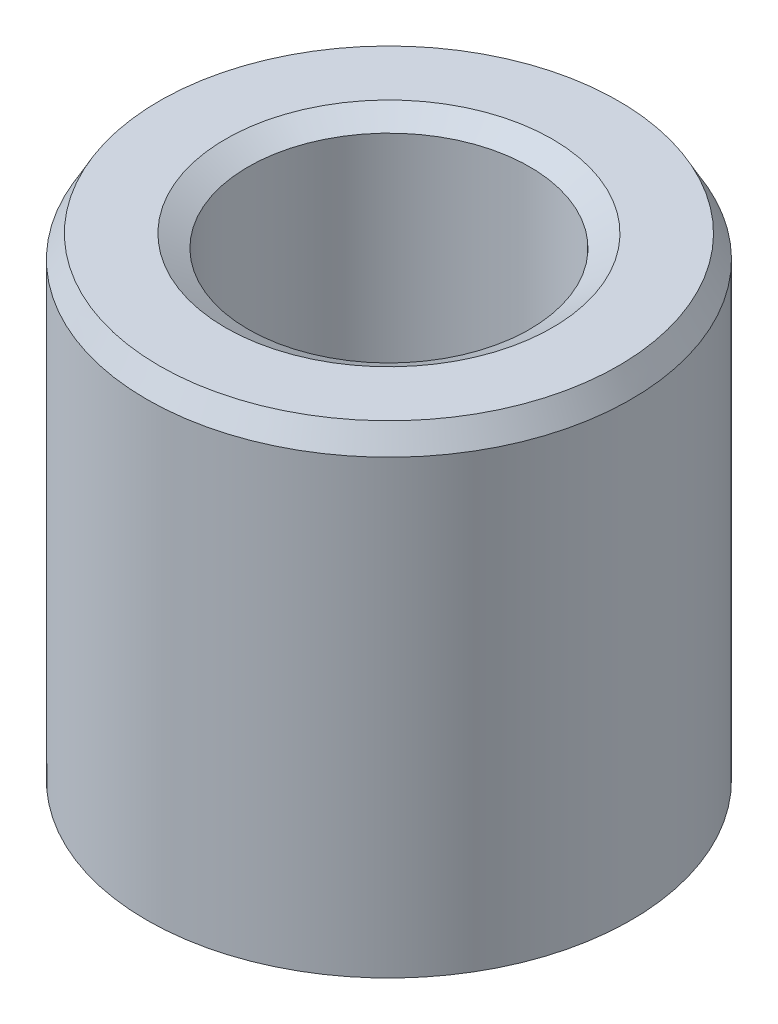
from build123d import *
from OCP.BRepFilletAPI import BRepFilletAPI_MakeChamfer

# Parameters (mm, degrees)
SKETCH1_R           = 30
BOSS_EXTRUDE1_DEPTH = 60.238001532
SKETCH2_R           = 17.435476304
CUT_EXTRUDE1_DEPTH  = 74.679147855
CHAMFER1_SIZE       = 2.80098318
CHAMFER1_SIZE2      = 1.573773227


with BuildPart() as part:
    # Sketch1 → Boss-Extrude1 (new body)
    with BuildSketch(Plane(origin=(0, 0, 0), x_dir=(1, 0, 0), z_dir=(0, 1, 0))):
        Circle(SKETCH1_R)
    extrude(amount=BOSS_EXTRUDE1_DEPTH)

    # Sketch2 → Cut-Extrude1 (cut, through all)
    with BuildSketch(Plane(origin=(0, 0, 0), x_dir=(1, 0, 0), z_dir=(0, 1, 0))):
        Circle(SKETCH2_R)
    extrude(amount=CUT_EXTRUDE1_DEPTH, mode=Mode.SUBTRACT)

    # Chamfer1: one chamfer whose edges measure the first distance from different faces: ONE call of the kernel's chamfer builder (chamfer() names one face for all edges)
    chamfer1_edges_1 = [part.edges().sort_by_distance(p)[0] for p in [
        (-17.435476304, 60.238001532, 0),
    ]]
    chamfer1_side_1 = [part.faces().sort_by_distance(p)[0] for p in [
        (-29.151471863, 60.238001532, 0),
    ]]
    chamfer1_edges_2 = [part.edges().sort_by_distance(p)[0] for p in [
        (-17.435476304, 0, 0),
    ]]
    chamfer1_side_2 = [part.faces().sort_by_distance(p)[0] for p in [
        (-17.435476304, 30.119000766, 0),
    ]]
    chamfer1_edges_3 = [part.edges().sort_by_distance(p)[0] for p in [
        (-30, 0, 0),
    ]]
    chamfer1_side_3 = [part.faces().sort_by_distance(p)[0] for p in [
        (-29.151471863, 0, 0),
    ]]
    chamfer1_edges_4 = [part.edges().sort_by_distance(p)[0] for p in [
        (-30, 60.238001532, 0),
    ]]
    chamfer1_side_4 = [part.faces().sort_by_distance(p)[0] for p in [
        (-30, 30.119000766, 0),
    ]]
    chamfer1 = BRepFilletAPI_MakeChamfer(part.part.solid().wrapped)
    for e in chamfer1_edges_1:
        chamfer1.Add(CHAMFER1_SIZE, CHAMFER1_SIZE2, e.wrapped, chamfer1_side_1[0].wrapped)  # the first distance lies on this face
    for e in chamfer1_edges_2:
        chamfer1.Add(CHAMFER1_SIZE, CHAMFER1_SIZE2, e.wrapped, chamfer1_side_2[0].wrapped)  # the first distance lies on this face
    for e in chamfer1_edges_3:
        chamfer1.Add(CHAMFER1_SIZE, CHAMFER1_SIZE2, e.wrapped, chamfer1_side_3[0].wrapped)  # the first distance lies on this face
    for e in chamfer1_edges_4:
        chamfer1.Add(CHAMFER1_SIZE, CHAMFER1_SIZE2, e.wrapped, chamfer1_side_4[0].wrapped)  # the first distance lies on this face
    add(Compound.cast(chamfer1.Shape()), mode=Mode.REPLACE)


solid = part.part
